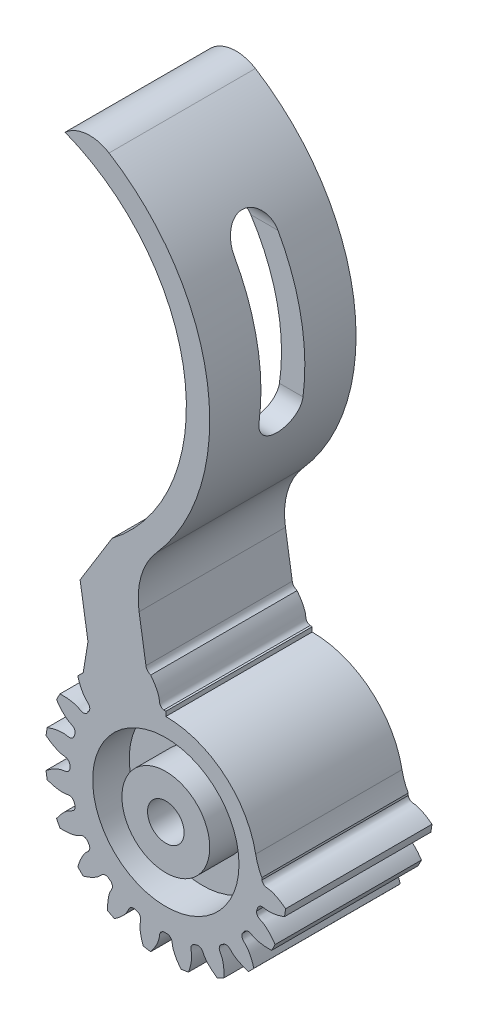
from build123d import *

# Parameters (mm, degrees)
SKETCH_1_R               = 16.5
EXTRUDE_1_DEPTH          = 20
CUT_EXTRUDE_1_DEPTH      = 31.732718721
PATTERN_CIRCULAR_1_COUNT = 20
EXTRUDE_START            = -20
EXTRUDE_2_DEPTH          = 20
FILLET_1_R               = 1
FILLET_2_R               = 5
FILLET_4_R               = 10
SKETCH_5_R               = 2.5
CUT_EXTRUDE_2_DEPTH      = 20
SKETCH_7_R               = 10
CUT_EXTRUDE_3_DEPTH      = 3
CUT_EXTRUDE_START        = -5
SKETCH_8_R               = 10
SKETCH_8_R_2             = 6
CUT_EXTRUDE_4_DEPTH      = 5
CUT_EXTRUDE_5_DEPTH      = 10
CUT_EXTRUDE_5_DEPTH_BACK = 10
CUT_EXTRUDE_6_DEPTH      = 25
FILLET_5_R               = 8


with BuildPart() as part:
    # 草图1 → 凸台-拉伸1 (new body)
    with BuildSketch(Plane.XY):
        Circle(SKETCH_1_R)
    extrude(amount=EXTRUDE_1_DEPTH)

    # 草图2 → 切除-拉伸1 (cut, through all)
    with BuildSketch(Plane.XY):
        with BuildLine():
            ThreePointArc((0.289974901, 13.121796354), (0, 13.125), (-0.289974901, 13.121796354))
            add(Edge.make_bspline(
                [(-0.289974901, 13.121796354), (-0.916784107, 13.340213268), (-0.835626149, 13.780670548), (-0.919345585, 14.205014104), (-0.928338279, 14.246334921), (-0.939466335, 14.292951923), (-0.952938145, 14.344795254), (-0.96896871, 14.401787245), (-0.987768083, 14.463844242), (-1.009544807, 14.5308761), (-1.034504625, 14.602786421), (-1.06285065, 14.679472568), (-1.094783098, 14.760825751), (-1.130499153, 14.846731096), (-1.170192797, 14.937067727), (-1.214054647, 15.031708847), (-1.2622718, 15.130521826), (-1.315027675, 15.233368292), (-1.372501858, 15.340104225), (-1.434869948, 15.450580056), (-1.502303414, 15.564640771), (-1.574969439, 15.682126017), (-1.653030782, 15.802870208), (-1.736645634, 15.926702646), (-1.825967477, 16.05344763), (-1.921144951, 16.182924586), (-2.022321721, 16.314948181), (-2.129636342, 16.449328459), (-2.24322214, 16.585870967), (-2.363207078, 16.724376892), (-2.489713645, 16.864643194), (-2.622858733, 17.006462752), (-2.762753527, 17.149624504), (-2.909503389, 17.29391359), (-3.06320776, 17.439111509), (-3.223960048, 17.584996263), (-3.391847534, 17.731342516), (-3.566951278, 17.877921749), (-3.749346018, 18.024502419), (-3.939100102, 18.170850122), (-4.136275349, 18.31672776), (-4.412210386, 18.512459802), (-4.625898619, 18.654498902), (-4.771736973, 18.747377789)],
                knots=[0, 0, 0, 0, 0.165916003, 0.170905922, 0.176663519, 0.183188797, 0.190481754, 0.198542391, 0.207370708, 0.216966704, 0.22733038, 0.238461736, 0.250360771, 0.263027487, 0.276461881, 0.290663956, 0.30563371, 0.321371144, 0.337876258, 0.355149051, 0.373189524, 0.391997677, 0.411573509, 0.431917021, 0.453028213, 0.474907084, 0.497553636, 0.520967867, 0.545149777, 0.570099367, 0.595816637, 0.622301587, 0.649554216, 0.677574526, 0.706362514, 0.735918183, 0.766241531, 0.797332559, 0.829191267, 0.861817654, 0.895211721, 0.929373468, 1, 1, 1, 1], degree=3))
            ThreePointArc((-4.771736973, 18.747377789), (0, 19.345119481), (4.771736973, 18.747377789))
            add(Edge.make_bspline(
                [(0.289974901, 13.121796354), (0.916784107, 13.340213268), (0.835626149, 13.780670548), (0.919345585, 14.205014104), (0.928338279, 14.246334921), (0.939466335, 14.292951923), (0.952938145, 14.344795254), (0.96896871, 14.401787245), (0.987768083, 14.463844242), (1.009544807, 14.5308761), (1.034504625, 14.602786421), (1.06285065, 14.679472568), (1.094783098, 14.760825751), (1.130499153, 14.846731096), (1.170192797, 14.937067727), (1.214054647, 15.031708847), (1.2622718, 15.130521826), (1.315027675, 15.233368292), (1.372501858, 15.340104225), (1.434869948, 15.450580056), (1.502303414, 15.564640771), (1.574969439, 15.682126017), (1.653030782, 15.802870208), (1.736645634, 15.926702646), (1.825967477, 16.05344763), (1.921144951, 16.182924586), (2.022321721, 16.314948181), (2.129636342, 16.449328459), (2.24322214, 16.585870967), (2.363207078, 16.724376892), (2.489713645, 16.864643194), (2.622858733, 17.006462752), (2.762753527, 17.149624504), (2.909503389, 17.29391359), (3.06320776, 17.439111509), (3.223960048, 17.584996263), (3.391847534, 17.731342516), (3.566951278, 17.877921749), (3.749346018, 18.024502419), (3.939100102, 18.170850122), (4.136275349, 18.31672776), (4.412210386, 18.512459802), (4.625898619, 18.654498902), (4.771736973, 18.747377789)],
                knots=[0, 0, 0, 0, 0.165916003, 0.170905922, 0.176663519, 0.183188797, 0.190481754, 0.198542391, 0.207370708, 0.216966704, 0.22733038, 0.238461736, 0.250360771, 0.263027487, 0.276461881, 0.290663956, 0.30563371, 0.321371144, 0.337876258, 0.355149051, 0.373189524, 0.391997677, 0.411573509, 0.431917021, 0.453028213, 0.474907084, 0.497553636, 0.520967867, 0.545149777, 0.570099367, 0.595816637, 0.622301587, 0.649554216, 0.677574526, 0.706362514, 0.735918183, 0.766241531, 0.797332559, 0.829191267, 0.861817654, 0.895211721, 0.929373468, 1, 1, 1, 1], degree=3))
        make_face()
    cut_extrude_1 = extrude(amount=CUT_EXTRUDE_1_DEPTH, mode=Mode.SUBTRACT)

    # 阵列(圆周)1: 切除-拉伸1 ×20 about axis
    pattern_circular_1_axis = Axis((0, 0, -1.5), (0, 0, 1))
    for i in range(1, PATTERN_CIRCULAR_1_COUNT):
        add(cut_extrude_1.rotate(pattern_circular_1_axis, i * 360 / PATTERN_CIRCULAR_1_COUNT), mode=Mode.SUBTRACT)


with BuildPart() as extrude_2_tool:
    # 草图4 → 凸台-拉伸2 (new body)
    with BuildSketch(Plane.XY.offset(20).offset(EXTRUDE_START)):
        with BuildLine():
            ThreePointArc((-13.768003709, 74.766711998), (2.797937041, 51.298769547), (-12.359888978, 26.897641987))
            Line((-12.359888978, 26.897641987), (-10.638462888, 16.028985398))
            Line((-10.638462888, 16.028985398), (-9.921456121, 11.501982843))
            add(Edge.make_bspline(
                [(-9.921456121, 11.501982843), (-9.918703082, 11.500559653), (-9.852537081, 11.466286234), (-9.730890834, 11.400191512), (-9.589612349, 11.315967266), (-9.466858859, 11.237556123), (-9.37982057, 11.17834971), (-9.300755502, 11.120900284), (-9.249070303, 11.081745113), (-9.202602252, 11.045060153), (-9.150343301, 11.002082969), (-9.104978437, 10.962582681), (-8.776110671, 10.657627941), (-8.582874544, 10.253587065), (-7.947393003, 10.445313277)],
                knots=[0.69310037, 0.69310037, 0.69310037, 0.69310037, 0.69436629, 0.723538119, 0.749639229, 0.761538264, 0.783033296, 0.792629292, 0.801457609, 0.809518246, 0.816811203, 0.829094078, 0.834083997, 1, 1, 1, 1], degree=3))
            ThreePointArc((-7.947393003, 10.445313277), (-7.714681436, 10.618348051), (-7.478203758, 10.786199217))
            add(Edge.make_bspline(
                [(-7.478203758, 10.786199217), (-7.099486698, 11.33133142), (-7.424039159, 11.639965394), (-7.612442624, 12.046973423), (-7.635991116, 12.102324233), (-7.660715943, 12.16530613), (-7.681245996, 12.220836149), (-7.71083511, 12.306060717), (-7.748703597, 12.427161912), (-7.792731572, 12.590510669), (-7.835215538, 12.777480211), (-7.874329115, 12.988173006), (-7.908236264, 13.222583157), (-7.935097524, 13.480595599), (-7.953075711, 13.761985925), (-7.960341751, 14.066420428), (-7.956565619, 14.30111124), (-7.951281332, 14.434194698), (-7.950219677, 14.458354231)],
                knots=[0, 0, 0, 0, 0.165916003, 0.170905922, 0.183188797, 0.190481754, 0.198542391, 0.207370708, 0.22733038, 0.250360771, 0.276461881, 0.30563371, 0.337876258, 0.373189524, 0.411573509, 0.453028213, 0.497553636, 0.507431698, 0.507431698, 0.507431698, 0.507431698], degree=3))
            ThreePointArc((-7.950219677, 14.458354231), (-7.490843246, 14.701607649), (-7.024032405, 14.930270218))
            add(Edge.make_bspline(
                [(-7.024032405, 14.930270218), (-6.912948778, 14.856790614), (-6.720224904, 14.722766352), (-6.458979768, 14.52326582), (-6.24189748, 14.343324096), (-6.048949658, 14.169936981), (-5.879237949, 14.004722705), (-5.731774221, 13.849237063), (-5.623437121, 13.725477592), (-5.530921989, 13.612971249), (-5.466439445, 13.529766293), (-5.408996946, 13.450696193), (-5.371941014, 13.397485807), (-5.339083547, 13.34823692), (-5.302663012, 13.291214284), (-5.271724722, 13.239628764), (-5.053189088, 12.847973843), (-4.994266108, 12.403994888), (-4.330640589, 12.389962756)],
                knots=[0.492568302, 0.492568302, 0.492568302, 0.492568302, 0.546971787, 0.588426491, 0.626810476, 0.662123742, 0.69436629, 0.723538119, 0.749639229, 0.761538264, 0.783033296, 0.792629292, 0.801457609, 0.809518246, 0.816811203, 0.829094078, 0.834083997, 1, 1, 1, 1], degree=3))
            ThreePointArc((-4.330640589, 12.389962756), (-4.055848051, 12.482616776), (-3.779075551, 12.5691771))
            add(Edge.make_bspline(
                [(-3.779075551, 12.5691771), (-3.250439109, 12.970598627), (-3.463733699, 13.364419205), (-3.517143644, 13.809726715), (-3.522435249, 13.869645348), (-3.526487481, 13.937185083), (-3.528853002, 13.996341404), (-3.530658082, 14.086538325), (-3.529250826, 14.213414411), (-3.520646377, 14.382373703), (-3.503274264, 14.573320573), (-3.475365832, 14.785788088), (-3.435176726, 15.019203275), (-3.380993074, 15.272888275), (-3.311136952, 15.546061943), (-3.223971932, 15.837841691), (-3.147857168, 16.059879028), (-3.101706462, 16.184815984), (-3.093231062, 16.207464996)],
                knots=[0, 0, 0, 0, 0.165916003, 0.170905922, 0.183188797, 0.190481754, 0.198542391, 0.207370708, 0.22733038, 0.250360771, 0.276461881, 0.30563371, 0.337876258, 0.373189524, 0.411573509, 0.453028213, 0.497553636, 0.507431698, 0.507431698, 0.507431698, 0.507431698], degree=3))
            Line((-3.093231062, 16.207464996), (-2.581168673, 16.29685762))
            Line((-2.581168673, 16.29685762), (-4.458382254, 28.149117707))
            ThreePointArc((-4.458382254, 28.149117707), (5.362999443, 56.590630412), (-15.158382909, 78.59635807))
            Line((-15.158382909, 78.59635807), (-13.768003709, 74.766711998))
        make_face()
        with BuildLine():
            Line((-9.921456121, 11.501982843), (-10.638462888, 16.028985398))
            Line((-10.638462888, 16.028985398), (-11.293959017, 12.028985398))
            add(Edge.make_bspline(
                [(-11.293959017, 12.028985398), (-11.165605763, 11.993428871), (-10.940898693, 11.925519176), (-10.630790749, 11.816512081), (-10.368728174, 11.712459448), (-10.134477341, 11.608440656), (-9.988822046, 11.536807812), (-9.921456121, 11.501982843)],
                knots=[0.492568302, 0.492568302, 0.492568302, 0.492568302, 0.546971787, 0.588426491, 0.626810476, 0.662123742, 0.69310037, 0.69310037, 0.69310037, 0.69310037], degree=3))
        make_face()
    extrude(amount=EXTRUDE_2_DEPTH)


with BuildPart() as part_1:
    add(part.part)


with BuildPart() as part_2:
    # 凸台-拉伸2: joined with extrude_2_tool
    add(part_1.part.fuse(extrude_2_tool.part, tol=0.00001))

    # 圆角1
    # the kernel refuses this fillet: 1 mm, written as the material it adds along each edge
    with BuildSketch(Plane(origin=(-2.581168673, 16.29685762, 0), x_dir=(0.9900299133467207, 0.1408572705922011, 0), z_dir=(0, 0, 1))) as fillet_1_piece_1:
        with BuildLine():
            CenterArc((0.986188646, 0.884583413), FILLET_1_R, 180.902544173, 61.297755274)
            Line((-0.013687288, 0.868831697), (-0.033684807, 0.868516662))
            Line((-0.033684807, 0.868516662), (-0.019997519, -0.000315034))
            Line((-0.019997519, -0.000315034), (0.000315034, -0.019997519))
            ThreePointArc((0.000315034, -0.019997519), (0.259903314, -0.017952911), (0.510478988, -0.017691668))
            Line((0.510478988, -0.017691668), (0.519806629, 0))
        make_face()
    extrude(amount=20)

    # 圆角2
    # the kernel refuses this fillet: 5 mm, written as the material it takes off along each edge
    with BuildSketch(Plane(origin=(-15.158382909, 78.59635807, -20.234337308), x_dir=(0.9139531845211503, -0.405819635433832, 0), z_dir=(0, 0, 1))) as fillet_2_piece_1:
        with BuildLine():
            CenterArc((7.400517949, -4.951711848), FILLET_2_R, 82.030647046, 74.193004999)
            Line((2.82488707, -2.935874043), (2.733374453, -2.895557287))
            ThreePointArc((2.733374453, -2.895557287), (1.340383916, -1.537272519), (-0.07205962, -0.069335498))
            Line((-0.07205962, -0.069335498), (-0.013864339, 0.099034237))
            ThreePointArc((-0.013864339, 0.099034237), (4.046867462, 0.38189695), (8.107599263, 0.099034237))
            Line((8.107599263, 0.099034237), (8.093734923, 0))
        make_face()
    extrude(amount=60.468674615, mode=Mode.SUBTRACT)

    # 圆角4
    fillet_4_edges = [part_2.edges().sort_by_distance(p)[0] for p in [
        (-4.458382254, 28.149117707, 10),
    ]]
    fillet(fillet_4_edges, radius=FILLET_4_R)

    # 草图5 → 切除-拉伸2 (cut)
    with BuildSketch(Plane.XY.offset(20)):
        Circle(SKETCH_5_R)
    extrude(amount=-CUT_EXTRUDE_2_DEPTH, mode=Mode.SUBTRACT)

    # 倒角1
    # the kernel refuses this chamfer: 7.206221188, 5 mm, written as the material it takes off along each edge
    with BuildSketch(Plane(origin=(-12.359888978, 26.897641987, -15.305906315), x_dir=(0.8563189904160002, 0.5164472738362769, 0), z_dir=(0, 0, 1))) as chamfer_1_piece_1:
        with BuildLine():
            Line((6.120939246, 0.132006216), (-1.806978449, -3.952102234))
            Line((-1.806978449, -3.952102234), (-1.940519302, -3.89789255))
            ThreePointArc((-1.940519302, -3.89789255), (-0.950036223, -1.95715579), (-0.133540854, 0.054209685))
            Line((-0.133540854, 0.054209685), (0.016254723, 0.143204865))
            ThreePointArc((0.016254723, 0.143204865), (3.060904423, -0.021443994), (6.104684523, 0.275211082))
            Line((6.104684523, 0.275211082), (6.120939246, 0.132006216))
        make_face()
    extrude(amount=50.61181263, mode=Mode.SUBTRACT)

    # 草图7 → 切除-拉伸3 (cut)
    with BuildSketch(Plane(origin=(0, 0, 0), x_dir=(-1, 0, 0), z_dir=(0, 0, -1))):
        Circle(SKETCH_7_R)
    extrude(amount=-CUT_EXTRUDE_3_DEPTH, mode=Mode.SUBTRACT)

    # 草图8 → 切除-拉伸4 (cut)
    with BuildSketch(Plane.XY.offset(20).offset(CUT_EXTRUDE_START)):
        with Locations(Location((0, 0, 0), (0, 0, 180))):
            Circle(SKETCH_8_R)
        Circle(SKETCH_8_R_2, mode=Mode.SUBTRACT)
    extrude(amount=CUT_EXTRUDE_4_DEPTH, mode=Mode.SUBTRACT)

    # 草图9 → 切除-拉伸5 (cut, two sides: drawn at the far end of the back side and taken through both)
    with BuildSketch(Plane(origin=(0, 0, 0), x_dir=(0, 0, -1), z_dir=(1, 0, 0)).offset(-CUT_EXTRUDE_5_DEPTH_BACK)):
        with BuildLine():
            Line((-13, 46.7), (-13, 64.7))
            ThreePointArc((-13, 64.7), (-10, 67.7), (-7, 64.7))
            Line((-7, 64.7), (-7, 46.7))
            ThreePointArc((-7, 46.7), (-10, 43.7), (-13, 46.7))
        make_face()
    extrude(amount=CUT_EXTRUDE_5_DEPTH + CUT_EXTRUDE_5_DEPTH_BACK, mode=Mode.SUBTRACT)

    # 草图10 → 切除-拉伸6 (cut)
    with BuildSketch(Plane(origin=(0, 0, 0), x_dir=(-1, 0, 0), z_dir=(0, 0, -1))):
        with BuildLine():
            Line((-20.474773561, 0), (-12.5, 0))
            ThreePointArc((-12.5, 0), (-8.838834765, 8.838834765), (0, 12.5))
            Line((0, 12.5), (0, 20.786666958))
            Line((0, 20.786666958), (-20.474773561, 20.786666958))
            Line((-20.474773561, 20.786666958), (-20.474773561, 0))
        make_face()
    extrude(amount=-CUT_EXTRUDE_6_DEPTH, mode=Mode.SUBTRACT)

    # 圆角5
    # the kernel refuses this fillet: 8 mm, written as the material it adds along each edge
    with BuildSketch(Plane(origin=(12.5, 0, 0), x_dir=(1, 0, 0), z_dir=(0, 0, 1))) as fillet_5_piece_1:
        with BuildLine():
            CenterArc((7.633928571, 3.85680182), FILLET_5_R, 190.844062564, 17.97859869)
            Line((-0.223214286, 2.351708427), (-0.380357143, 2.321606559))
            ThreePointArc((-0.380357143, 2.321606559), (-0.215212805, 1.166020399), (-0.16, 0))
            Line((-0.16, 0), (0, -0.16))
            ThreePointArc((0, -0.16), (0.3125, -0.16), (0.484821429, -0.077136036))
            Line((0.484821429, -0.077136036), (0.625, 0))
        make_face()
    extrude(amount=20)


solid = part_2.part
